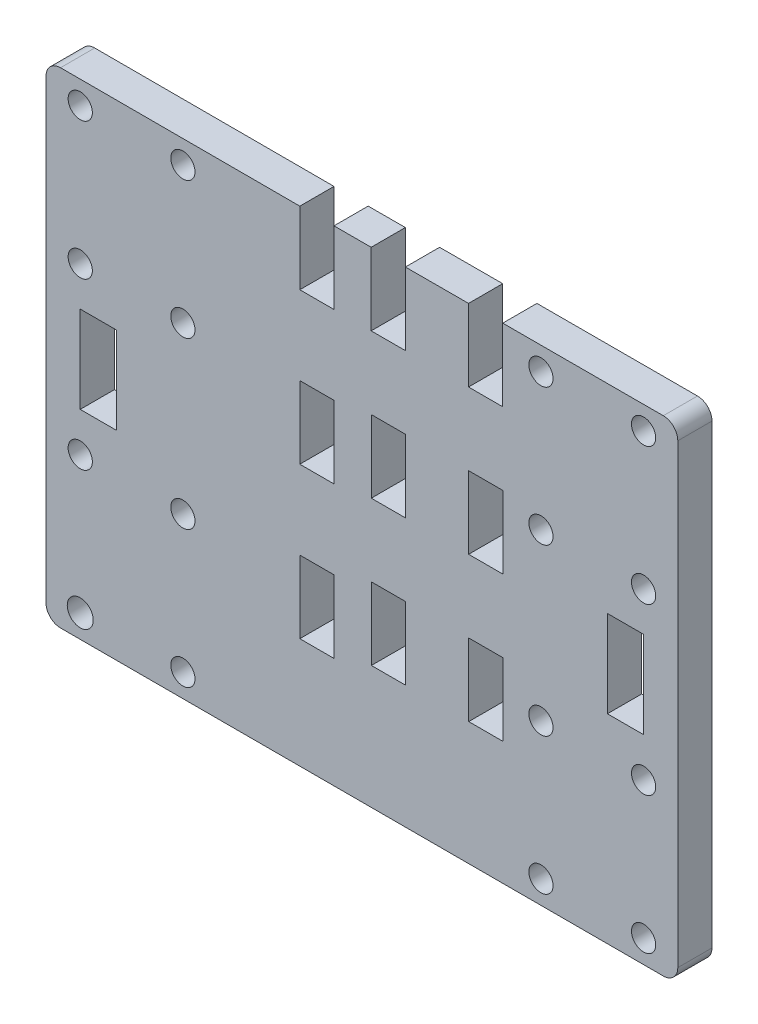
from build123d import *

# Parameters (mm, degrees)
SKETCH1_R           = 2.281562065
SKETCH1_R_2         = 2.125
SKETCH1_W           = 5.9944
SKETCH1_H           = 12.7
SKETCH1_W_2         = 5.986441201
SKETCH1_H_2         = 12.703753504
SKETCH1_W_3         = 5.986441202
BOSS_EXTRUDE1_DEPTH = 5.9944


with BuildPart() as part:
    # Sketch1 → Boss-Extrude1 (new body)
    with BuildSketch(Plane.XY):
        with BuildLine():
            Line((270.254984812, 144.069366268), (333.659384812, 144.069366268))
            Line((333.659384812, 144.069366268), (339.653784812, 144.069366268))
            Line((339.653784812, 144.069366268), (375.974984812, 144.069366268))
            ThreePointArc((375.974984812, 144.069366268), (377.771036036, 144.813315043), (378.514984812, 146.609366268))
            Line((378.514984812, 146.609366268), (378.514984812, 226.632730682))
            ThreePointArc((378.514984812, 226.632730682), (377.770473259, 228.429344507), (375.973393287, 229.172730183))
            Line((375.973393287, 229.172730183), (347.813544609, 229.155085658))
            Line((347.813544609, 229.155085658), (347.813544609, 216.451324674))
            Line((347.813544609, 216.451324674), (341.815166975, 216.451324674))
            Line((341.815166975, 216.451324674), (341.815166975, 229.155085658))
            Line((341.815166975, 229.155085658), (330.740769149, 229.140627138))
            Line((330.740769149, 229.140627138), (330.740769149, 216.444385628))
            Line((330.740769149, 216.444385628), (324.738412704, 216.444385628))
            Line((324.738412704, 216.444385628), (324.738412704, 229.140627138))
            Line((324.738412704, 229.140627138), (318.219144609, 229.136542265))
            Line((318.219144609, 229.136542265), (318.219144609, 216.431429486))
            Line((318.219144609, 216.431429486), (312.224744609, 216.431429486))
            Line((312.224744609, 216.431429486), (312.224744609, 229.131429486))
            Line((312.224744609, 229.131429486), (270.25739927, 229.171322574))
            ThreePointArc((270.25739927, 229.171322574), (268.45978743, 228.428228383), (267.714984812, 226.631323721))
            Line((267.714984812, 226.631323721), (267.714984812, 146.609366268))
            ThreePointArc((267.714984812, 146.609366268), (268.458933587, 144.813315043), (270.254984812, 144.069366268))
        make_face()
        with Locations((273.714984812, 148.112259486)):
            Circle(SKETCH1_R, mode=Mode.SUBTRACT)
        with Locations((291.714984812, 148.112259486)):
            Circle(SKETCH1_R_2, mode=Mode.SUBTRACT)
        with Locations((273.714984812, 172.112259486)):
            Circle(SKETCH1_R_2, mode=Mode.SUBTRACT)
        with Locations((291.714984812, 172.112259486)):
            Circle(SKETCH1_R_2, mode=Mode.SUBTRACT)
        Polygon((273.709384812, 179.000344994), (273.709384812, 186.620344994), (273.709384812, 194.240344994), (280.059384812, 194.240344994), (280.059384812, 179.000344994), align=None, mode=Mode.SUBTRACT)
        with Locations((315.221944609, 169.781429486)):
            Rectangle(SKETCH1_W, SKETCH1_H, mode=Mode.SUBTRACT)
        with Locations((354.514984812, 148.112259486)):
            Circle(SKETCH1_R_2, mode=Mode.SUBTRACT)
        with Locations((372.514984812, 148.112259486)):
            Circle(SKETCH1_R_2, mode=Mode.SUBTRACT)
        with Locations((327.771421413, 171.992516355)):
            Rectangle(SKETCH1_W_2, SKETCH1_H_2, mode=Mode.SUBTRACT)
        with Locations((344.840218063, 172.003211399)):
            Rectangle(SKETCH1_W_3, SKETCH1_H_2, mode=Mode.SUBTRACT)
        with Locations((354.514984812, 172.112259486)):
            Circle(SKETCH1_R_2, mode=Mode.SUBTRACT)
        with Locations((372.514984812, 172.112259486)):
            Circle(SKETCH1_R_2, mode=Mode.SUBTRACT)
        Polygon((372.520584812, 186.620344994), (372.520584812, 179.000344994), (366.170584812, 179.000344994), (366.170584812, 194.240344994), (372.520584812, 194.240344994), align=None, mode=Mode.SUBTRACT)
        with Locations((273.714984812, 201.131429486)):
            Circle(SKETCH1_R_2, mode=Mode.SUBTRACT)
        with Locations((291.714984812, 201.131429486)):
            Circle(SKETCH1_R_2, mode=Mode.SUBTRACT)
        with Locations((315.221944609, 196.281429486)):
            Rectangle(SKETCH1_W, SKETCH1_H, mode=Mode.SUBTRACT)
        with Locations((273.714984812, 225.131429486)):
            Circle(SKETCH1_R_2, mode=Mode.SUBTRACT)
        with Locations((291.714984812, 225.131429486)):
            Circle(SKETCH1_R_2, mode=Mode.SUBTRACT)
        with Locations((327.75550617, 197.392511369)):
            Rectangle(SKETCH1_W_3, SKETCH1_H_2, mode=Mode.SUBTRACT)
        with Locations((344.82430282, 197.403206413)):
            Rectangle(SKETCH1_W_2, SKETCH1_H_2, mode=Mode.SUBTRACT)
        with Locations((354.514984812, 201.131429486)):
            Circle(SKETCH1_R_2, mode=Mode.SUBTRACT)
        with Locations((372.514984812, 201.131429486)):
            Circle(SKETCH1_R_2, mode=Mode.SUBTRACT)
        with Locations((354.514984812, 225.131429486)):
            Circle(SKETCH1_R_2, mode=Mode.SUBTRACT)
        with Locations((372.514984812, 225.131429486)):
            Circle(SKETCH1_R_2, mode=Mode.SUBTRACT)
    extrude(amount=BOSS_EXTRUDE1_DEPTH)


solid = part.part
